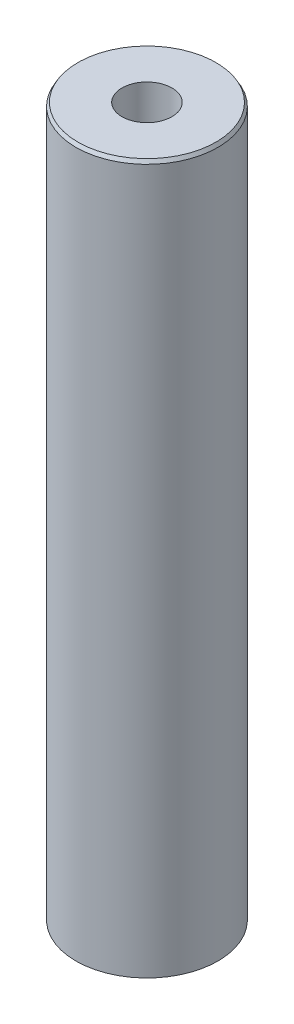
from build123d import *
from OCP.BRepFilletAPI import BRepFilletAPI_MakeChamfer

# Parameters (mm, degrees)
SKETCH1_R           = 60
BOSS_EXTRUDE1_DEPTH = 600
SKETCH2_R           = 21.089142119
CUT_EXTRUDE1_DEPTH  = 606.970296302
CHAMFER1_SIZE       = 2.965594104
CHAMFER1_SIZE2      = 1.712186554


with BuildPart() as part:
    # Sketch1 → Boss-Extrude1 (new body)
    with BuildSketch(Plane(origin=(0, 0, 0), x_dir=(1, 0, 0), z_dir=(0, 1, 0))):
        Circle(SKETCH1_R)
    extrude(amount=BOSS_EXTRUDE1_DEPTH)

    # Sketch2 → Cut-Extrude1 (cut, through all)
    with BuildSketch(Plane(origin=(0, 0, 0), x_dir=(1, 0, 0), z_dir=(0, 1, 0))):
        Circle(SKETCH2_R)
    extrude(amount=CUT_EXTRUDE1_DEPTH, mode=Mode.SUBTRACT)

    # Chamfer1: one chamfer whose edges measure the first distance from different faces: ONE call of the kernel's chamfer builder (chamfer() names one face for all edges)
    chamfer1_edges_1 = [part.edges().sort_by_distance(p)[0] for p in [
        (-60, 600, 0),
    ]]
    chamfer1_side_1 = [part.faces().sort_by_distance(p)[0] for p in [
        (-60, 300, 0),
    ]]
    chamfer1_edges_2 = [part.edges().sort_by_distance(p)[0] for p in [
        (-60, 0, 0),
    ]]
    chamfer1_side_2 = [part.faces().sort_by_distance(p)[0] for p in [
        (-58.302943725, 0, 0),
    ]]
    chamfer1 = BRepFilletAPI_MakeChamfer(part.part.solid().wrapped)
    for e in chamfer1_edges_1:
        chamfer1.Add(CHAMFER1_SIZE, CHAMFER1_SIZE2, e.wrapped, chamfer1_side_1[0].wrapped)  # the first distance lies on this face
    for e in chamfer1_edges_2:
        chamfer1.Add(CHAMFER1_SIZE, CHAMFER1_SIZE2, e.wrapped, chamfer1_side_2[0].wrapped)  # the first distance lies on this face
    add(Compound.cast(chamfer1.Shape()), mode=Mode.REPLACE)


solid = part.part
